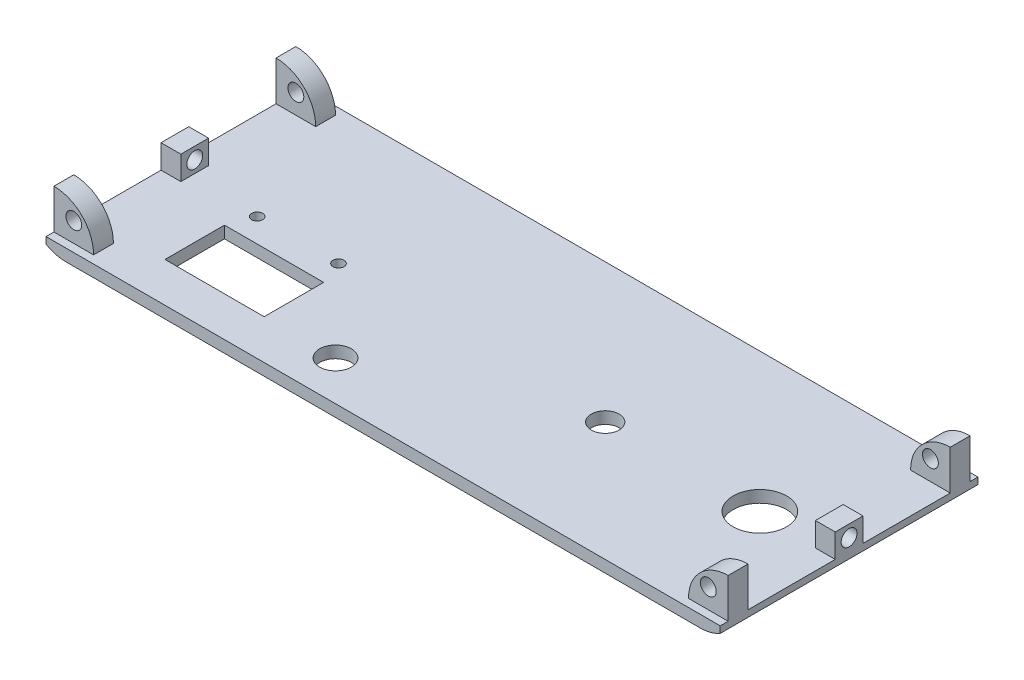
from build123d import *

# Parameters (mm, degrees)
SKIZZE1_W                                  = 180
SKIZZE1_H                                  = 65
AUFSATZ_LINEAR_AUSTRAGEN1_DEPTH            = 3
SKIZZE2_W                                  = 25
SKIZZE2_H                                  = 15
SCHNITT_LINEAR_AUSTRAGEN1_DEPTH            = 3
SKIZZE3_W                                  = 5
SKIZZE3_H                                  = 7
AUFSATZ_LINEAR_AUSTRAGEN2_DEPTH            = 6
F_4_0_4_DURCHMESSER_BOHRUNG1_D             = 4
SCHNITT_LINEAR_AUSTRAGEN4_DEPTH            = 112.382224794
SKIZZE7_W                                  = 10
SKIZZE7_H                                  = 5
AUFSATZ_LINEAR_AUSTRAGEN3_DEPTH            = 10
SPIEGELN1_AT_THE_SECOND_PLANE_COPY_1_SKE_W = 10
SPIEGELN1_AT_THE_SECOND_PLANE_COPY_1_SKE_H = 5
SPIEGELN1_AT_THE_SECOND_PLANE_COPY_1_DEPTH = 10
VERRUNDUNG2_R                              = 10
F_4_0_4_DURCHMESSER_BOHRUNG3_D             = 4
F_4_0_4_DURCHMESSER_BOHRUNG3_DEPTH         = 5
F_4_0_4_DURCHMESSER_BOHRUNG4_D             = 4
F_4_0_4_DURCHMESSER_BOHRUNG4_DEPTH         = 5
SKIZZE14_R                                 = 3.5
SKIZZE14_R_2                               = 6.75
SKIZZE14_R_3                               = 4
SCHNITT_LINEAR_AUSTRAGEN5_DEPTH            = 92.549167118
SKIZZE17_R                                 = 1.4
SCHNITT_LINEAR_AUSTRAGEN6_DEPTH            = 2


with BuildPart() as part:
    # Skizze1 → Aufsatz-Linear austragen1 (new body)
    with BuildSketch(Plane(origin=(0, 0, 0), x_dir=(1, 0, 0), z_dir=(0, 1, 0))):
        Rectangle(SKIZZE1_W, SKIZZE1_H)
    extrude(amount=AUFSATZ_LINEAR_AUSTRAGEN1_DEPTH)

    # Skizze2 → Schnitt-Linear austragen1 (cut)
    with BuildSketch(Plane(origin=(0, 0, 0), x_dir=(-1, 0, 0), z_dir=(0, -1, 0))):
        with Locations((52.5, -15)):
            Rectangle(SKIZZE2_W, SKIZZE2_H)
    extrude(amount=-SCHNITT_LINEAR_AUSTRAGEN1_DEPTH, mode=Mode.SUBTRACT)

    # Skizze3 → Aufsatz-Linear austragen2 (add)
    with BuildSketch(Plane(origin=(0, 3, 0), x_dir=(1, 0, 0), z_dir=(0, 1, 0))):
        with Locations((-82.5, 0)):
            Rectangle(SKIZZE3_W, SKIZZE3_H)
        with Locations((82.5, 0)):
            Rectangle(SKIZZE3_W, SKIZZE3_H)
    extrude(amount=AUFSATZ_LINEAR_AUSTRAGEN2_DEPTH)

    # Ø4.0 (4) Durchmesser Bohrung1 (through all)
    with Locations(Plane.ZY.offset(85)):
        with Locations((0, 6)):
            Hole(F_4_0_4_DURCHMESSER_BOHRUNG1_D / 2)

    # Skizze4 → Schnitt-Linear austragen4 (cut, through all)
    with BuildSketch(Plane.XY.offset(32.5)):
        with BuildLine():
            Line((-80, 0), (-90, 0))
            Line((-90, 0), (-90, 3))
            Line((-90, 3), (-85, 3))
            Line((-85, 3), (-85, 1.339745962))
            ThreePointArc((-85, 1.339745962), (-82.588190451, 0.340741737), (-80, 0))
        make_face()
        with BuildLine():
            Line((80, 0), (90, 0))
            Line((90, 0), (90, 3))
            Line((90, 3), (85, 3))
            Line((85, 3), (85, 1.339745962))
            ThreePointArc((85, 1.339745962), (82.588190451, 0.340741737), (80, 0))
        make_face()
    extrude(amount=-SCHNITT_LINEAR_AUSTRAGEN4_DEPTH, mode=Mode.SUBTRACT)

    # Skizze7 → Aufsatz-Linear austragen3 (add)
    with BuildSketch(Plane(origin=(0, 3, 0), x_dir=(1, 0, 0), z_dir=(0, 1, 0))):
        with Locations((-80, 28)):
            Rectangle(SKIZZE7_W, SKIZZE7_H)
    aufsatz_linear_austragen3 = extrude(amount=AUFSATZ_LINEAR_AUSTRAGEN3_DEPTH)

    # Spiegeln1: Aufsatz-Linear austragen3 across plane
    add(aufsatz_linear_austragen3.mirror(Plane(origin=(0, 0, 0), x_dir=(0, 0, 1), z_dir=(1, 0, 0))))

    # Spiegeln1 at the second plane: Aufsatz-Linear austragen3 across plane
    add(aufsatz_linear_austragen3.mirror(Plane.XY))

    # Spiegeln1 at the second plane copy 1 ske → Spiegeln1 at the second plane copy 1 (add)
    with BuildSketch(Plane(origin=(0, 3, 0), x_dir=(-1, 0, 0), z_dir=(0, 1, 0))):
        with Locations((-80, 28)):
            Rectangle(SPIEGELN1_AT_THE_SECOND_PLANE_COPY_1_SKE_W, SPIEGELN1_AT_THE_SECOND_PLANE_COPY_1_SKE_H)
    extrude(amount=SPIEGELN1_AT_THE_SECOND_PLANE_COPY_1_DEPTH)

    # Verrundung2
    verrundung2_edges = [part.edges().sort_by_distance(p)[0] for p in [
        (-75, 13, -28),
        (-75, 13, 28),
        (75, 13, -28),
        (75, 13, 28),
    ]]
    fillet(verrundung2_edges, radius=VERRUNDUNG2_R - 0.0001)  # a hair under: the kernel refuses the full size

    # Ø4.0 (4) Durchmesser Bohrung3
    with Locations(Plane(origin=(0, 0, -30.5), x_dir=(-1, 0, 0), z_dir=(0, 0, -1))):
        with Locations((-80, 8), (80, 8)):
            Hole(F_4_0_4_DURCHMESSER_BOHRUNG3_D / 2, depth=F_4_0_4_DURCHMESSER_BOHRUNG3_DEPTH)

    # Ø4.0 (4) Durchmesser Bohrung4
    with Locations(Plane.XY.offset(30.5)):
        with Locations((-80, 8), (80, 8)):
            Hole(F_4_0_4_DURCHMESSER_BOHRUNG4_D / 2, depth=F_4_0_4_DURCHMESSER_BOHRUNG4_DEPTH)

    # Skizze14 → Schnitt-Linear austragen5 (cut, through all)
    with BuildSketch(Plane(origin=(0, 3, 0), x_dir=(1, 0, 0), z_dir=(0, 1, 0))):
        with Locations(Location((26, -2.5, 0), (0, 0, 270))):
            Circle(SKIZZE14_R)
        with Locations(Location((65, -2.5, 0), (0, 0, 270))):
            Circle(SKIZZE14_R_2)
        with Locations(Location((-22, -22.5, 0), (0, 0, 270))):
            Circle(SKIZZE14_R_3)
    extrude(amount=-SCHNITT_LINEAR_AUSTRAGEN5_DEPTH, mode=Mode.SUBTRACT)

    # Skizze17 → Schnitt-Linear austragen6 (cut)
    with BuildSketch(Plane(origin=(0, 3, 0), x_dir=(1, 0, 0), z_dir=(0, 1, 0))):
        with Locations(Location((-62.75, -1.5, 0), (0, 0, 270))):
            Circle(SKIZZE17_R)
        with Locations(Location((-42.25, -1.5, 0), (0, 0, 270))):
            Circle(SKIZZE17_R)
    extrude(amount=-SCHNITT_LINEAR_AUSTRAGEN6_DEPTH, mode=Mode.SUBTRACT)


solid = part.part
